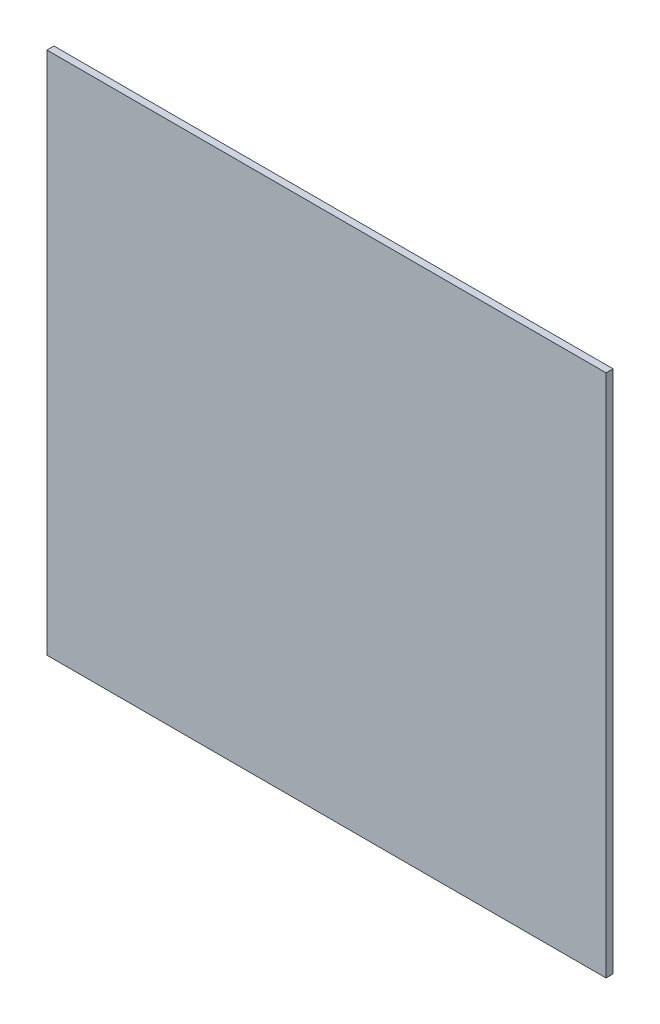
from build123d import *

# Parameters (mm, degrees)
SKETCH_1_W      = 800
SKETCH_1_H      = 750
EXTRUDE_1_DEPTH = 10


with BuildPart() as part:
    # Эскиз1 → Бобышка-Вытянуть1 (new body)
    with BuildSketch(Plane.XY):
        with Locations((400, 375)):
            Rectangle(SKETCH_1_W, SKETCH_1_H)
    extrude(amount=EXTRUDE_1_DEPTH)


solid = part.part
